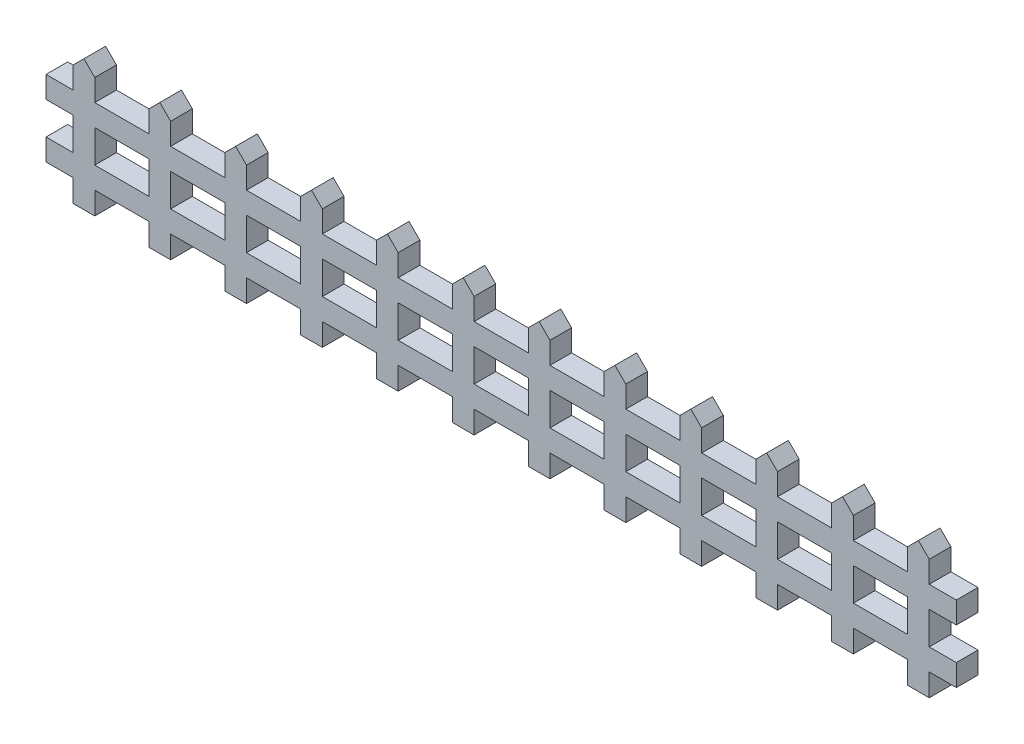
from build123d import *

# Parameters (mm, degrees)
SKETCH1_W                  = 6
SKETCH1_H                  = 10
BOSS_EXTRUDE1_DEPTH        = 4
CHAMFER1_SIZE              = 2
LPATTERN1_COUNT            = 6
LPATTERN1_PITCH            = 28
CHAMFER1_OF_LPATTERN1_SIZE = 2


with BuildPart() as part:
    # Sketch1 → Boss-Extrude1 (new body)
    with BuildSketch(Plane(origin=(0, 0, 0), x_dir=(0, 1, 0), z_dir=(0, 0, 1))):
        Polygon((84.991512901, 53.112203199), (82.991512901, 53.112203199), (80.857353011, 53.112203199), (80.857353011, 49.112203199), (82.991512901, 49.112203199), (84.991512901, 49.112203199), (84.991512901, 44.112203199), (88.991512901, 44.112203199), (88.991512901, 49.112203199), (94.991512901, 49.112203199), (94.991512901, 44.112203199), (98.991512901, 44.112203199), (98.991512901, 49.112203199), (100.991512901, 49.112203199), (105, 49.112203199), (105, 53.112203199), (100.991512901, 53.112203199), (98.991512901, 53.112203199), (98.991512901, 63.112203199), (100.991512901, 63.112203199), (105, 63.112203199), (105, 67.112203199), (100.991512901, 67.112203199), (98.991512901, 67.112203199), (98.991512901, 72.112203199), (94.991512901, 72.112203199), (94.991512901, 67.112203199), (88.991512901, 67.112203199), (88.991512901, 72.112203199), (84.991512901, 72.112203199), (84.991512901, 67.112203199), (82.991512901, 67.112203199), (80.857353011, 67.112203199), (80.857353011, 63.112203199), (82.991512901, 63.112203199), (84.991512901, 63.112203199), align=None)
        with Locations((91.991512901, 58.112203199)):
            Rectangle(SKETCH1_W, SKETCH1_H, mode=Mode.SUBTRACT)
    boss_extrude1 = extrude(amount=BOSS_EXTRUDE1_DEPTH)

    # Chamfer1
    chamfer1_edges = [part.edges().sort_by_distance(p)[0] for p in [
        (-49.112203199, 105, 2),
        (-53.112203199, 105, 2),
        (-63.112203199, 105, 2),
        (-67.112203199, 105, 2),
    ]]
    chamfer(chamfer1_edges, length=CHAMFER1_SIZE - 0.0001)  # a hair under: the kernel refuses the full size

    # LPattern1: Boss-Extrude1 ×6
    with Locations(*[(i * LPATTERN1_PITCH, 0, 0) for i in range(1, LPATTERN1_COUNT)]):
        add(boss_extrude1)

    # Chamfer1 of LPattern1
    chamfer1_of_lpattern1_edges = [part.edges().sort_by_distance(p)[0] for p in [
        (-21.112203199, 105, 2),
        (-25.112203199, 105, 2),
        (-35.112203199, 105, 2),
        (-39.112203199, 105, 2),
        (6.887796801, 105, 2),
        (2.887796801, 105, 2),
        (-7.112203199, 105, 2),
        (-11.112203199, 105, 2),
        (34.887796801, 105, 2),
        (30.887796801, 105, 2),
        (20.887796801, 105, 2),
        (16.887796801, 105, 2),
        (62.887796801, 105, 2),
        (58.887796801, 105, 2),
        (48.887796801, 105, 2),
        (44.887796801, 105, 2),
        (90.887796801, 105, 2),
        (86.887796801, 105, 2),
        (76.887796801, 105, 2),
        (72.887796801, 105, 2),
    ]]
    chamfer(chamfer1_of_lpattern1_edges, length=CHAMFER1_OF_LPATTERN1_SIZE - 0.0001)  # a hair under: the kernel refuses the full size


solid = part.part
